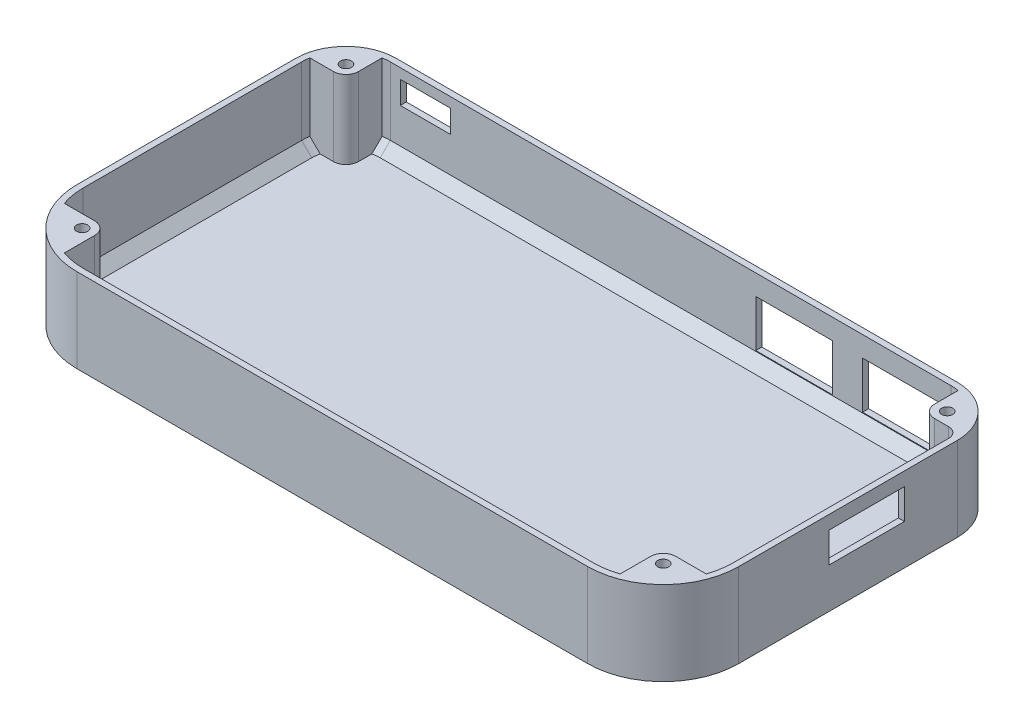
from build123d import *

# Parameters (mm, degrees)
ESBO_O1_W                   = 131.4
ESBO_O1_H                   = 68.4
BASE_DEPTH                  = 1.2
FILETE1_R                   = 15
FILETE2_R                   = 15
FILETE3_R                   = 10
FILETE4_R                   = 10
PAREDES_START               = 15.5
PAREDES_DEPTH               = 15.5
ESBO_O6_R                   = 2.5
SUPORTE_DOS_PARAFUSOS_DEPTH = 15.5
ESBO_O7_R                   = 1.1
FURO_DOS_PARAFUSOS_DEPTH    = 6
FECHAMENTOS_REACH           = 77.928
ESBO_O14_W                  = 10
ESBO_O14_H                  = 4.5
CORTE_DO_USB_DEPTH          = 10
ESBO_O16_W                  = 15.2
ESBO_O16_H                  = 9.3
CORTE_DAS_CHAVES_DEPTH      = 10
ESBO_O17_W                  = 15
ESBO_O17_H                  = 6
CORTE_SD_DEPTH              = 10
CHANFRO_BASE_INTERIOR_SIZE  = 2
FILETE5_R                   = 2


with BuildPart() as part:
    # Esboço1 → Base (new body)
    with BuildSketch(Plane(origin=(0, 0, 0), x_dir=(1, 0, 0), z_dir=(0, 1, 0))):
        Rectangle(ESBO_O1_W, ESBO_O1_H)
    extrude(amount=BASE_DEPTH)

    # Filete1
    filete1_edges = [part.edges().sort_by_distance(p)[0] for p in [
        (65.7, 0.6, 34.2),
    ]]
    fillet(filete1_edges, radius=FILETE1_R)

    # Filete2
    filete2_edges = [part.edges().sort_by_distance(p)[0] for p in [
        (-65.7, 0.6, 34.2),
    ]]
    fillet(filete2_edges, radius=FILETE2_R)

    # Filete3
    filete3_edges = [part.edges().sort_by_distance(p)[0] for p in [
        (65.7, 0.6, -34.2),
    ]]
    fillet(filete3_edges, radius=FILETE3_R)

    # Filete4
    filete4_edges = [part.edges().sort_by_distance(p)[0] for p in [
        (-65.7, 0.6, -34.2),
    ]]
    fillet(filete4_edges, radius=FILETE4_R)

    # Esboço5 → Paredes (add)
    with BuildSketch(Plane(origin=(0, 1.2, 0), x_dir=(1, 0, 0), z_dir=(0, 1, 0)).offset(PAREDES_START)):
        with BuildLine():
            Line((55.7, 34.2), (-55.7, 34.2))
            ThreePointArc((-55.7, 34.2), (-62.771067812, 31.271067812), (-65.7, 24.2))
            Line((-65.7, 24.2), (-65.7, -19.2))
            ThreePointArc((-65.7, -19.2), (-61.306601718, -29.806601718), (-50.7, -34.2))
            Line((-50.7, -34.2), (50.7, -34.2))
            ThreePointArc((50.7, -34.2), (61.306601718, -29.806601718), (65.7, -19.2))
            Line((65.7, -19.2), (65.7, 24.2))
            ThreePointArc((65.7, 24.2), (62.771067812, 31.271067812), (55.7, 34.2))
        make_face()
        with BuildLine():
            Line((55.7, 33), (-55.7, 33))
            ThreePointArc((-55.7, 33), (-61.922539674, 30.422539674), (-64.5, 24.2))
            Line((-64.5, 24.2), (-64.5, -19.2))
            ThreePointArc((-64.5, -19.2), (-60.45807358, -28.95807358), (-50.7, -33))
            Line((-50.7, -33), (50.7, -33))
            ThreePointArc((50.7, -33), (60.45807358, -28.95807358), (64.5, -19.2))
            Line((64.5, -19.2), (64.5, 24.2))
            ThreePointArc((64.5, 24.2), (61.922539674, 30.422539674), (55.7, 33))
        make_face(mode=Mode.SUBTRACT)
    extrude(amount=-PAREDES_DEPTH)

    # Esboço6 → Suporte dos parafusos (add)
    with BuildSketch(Plane(origin=(0, 1.2, 0), x_dir=(1, 0, 0), z_dir=(0, 1, 0))):
        with Locations(Location((-59.7, 28.2, 0), (0, 0, 90))):
            Circle(ESBO_O6_R)
        with Locations(Location((-57.7, -26.2, 0), (0, 0, 90))):
            Circle(ESBO_O6_R)
        with Locations(Location((59.7, 28.2, 0), (0, 0, 90))):
            Circle(ESBO_O6_R)
        with Locations(Location((57.7, -26.2, 0), (0, 0, 90))):
            Circle(ESBO_O6_R)
    extrude(amount=SUPORTE_DOS_PARAFUSOS_DEPTH)

    # Esboço7 → Furo dos parafusos (cut)
    with BuildSketch(Plane(origin=(0, 16.7, 0), x_dir=(1, 0, 0), z_dir=(0, 1, 0))):
        with Locations(Location((-59.7, 28.2, 0), (0, 0, 270))):
            Circle(ESBO_O7_R)
        with Locations(Location((59.7, 28.2, 0), (0, 0, 270))):
            Circle(ESBO_O7_R)
        with Locations(Location((57.7, -26.2, 0), (0, 0, 270))):
            Circle(ESBO_O7_R)
        with Locations(Location((-57.7, -26.2, 0), (0, 0, 270))):
            Circle(ESBO_O7_R)
    extrude(amount=-FURO_DOS_PARAFUSOS_DEPTH, mode=Mode.SUBTRACT)

    # Esboço23 → Fechamentos (add, up to next)
    with BuildSketch(Plane(origin=(0, 16.7, 0), x_dir=(1, 0, 0), z_dir=(0, 1, 0)), mode=Mode.PRIVATE) as fechamentos_sk1:
        with BuildLine():
            Line((57.2, 28.2), (57.2, 32.871216754))
            ThreePointArc((57.2, 32.871216754), (61.922539674, 30.422539674), (64.371216754, 25.7))
            Line((64.371216754, 25.7), (59.7, 25.7))
            Line((59.7, 25.7), (62.2, 28.2))
            Line((62.2, 28.2), (59.7, 30.7))
            Line((59.7, 30.7), (57.2, 28.2))
        make_face()
    fechamentos_tool1 = extrude(fechamentos_sk1.sketch, amount=-FECHAMENTOS_REACH, mode=Mode.PRIVATE) - part.part
    # Esboço23 → Fechamentos (add, up to next)
    with BuildSketch(Plane(origin=(0, 16.7, 0), x_dir=(1, 0, 0), z_dir=(0, 1, 0)), mode=Mode.PRIVATE) as fechamentos_sk2:
        with BuildLine():
            Line((-59.7, 25.7), (-64.371216754, 25.7))
            ThreePointArc((-64.371216754, 25.7), (-61.922539674, 30.422539674), (-57.2, 32.871216754))
            Line((-57.2, 32.871216754), (-57.2, 28.2))
            Line((-57.2, 28.2), (-59.7, 30.7))
            Line((-59.7, 30.7), (-62.2, 28.2))
            Line((-62.2, 28.2), (-59.7, 25.7))
        make_face()
    fechamentos_tool2 = extrude(fechamentos_sk2.sketch, amount=-FECHAMENTOS_REACH, mode=Mode.PRIVATE) - part.part
    # Esboço23 → Fechamentos (add, up to next)
    with BuildSketch(Plane(origin=(0, 16.7, 0), x_dir=(1, 0, 0), z_dir=(0, 1, 0)), mode=Mode.PRIVATE) as fechamentos_sk3:
        with BuildLine():
            Line((57.7, -23.7), (63.745688943, -23.7))
            ThreePointArc((63.745688943, -23.7), (60.45807358, -28.95807358), (55.2, -32.245688943))
            Line((55.2, -32.245688943), (55.2, -26.2))
            Line((55.2, -26.2), (57.7, -28.7))
            Line((57.7, -28.7), (60.2, -26.2))
            Line((60.2, -26.2), (57.7, -23.7))
        make_face()
    fechamentos_tool3 = extrude(fechamentos_sk3.sketch, amount=-FECHAMENTOS_REACH, mode=Mode.PRIVATE) - part.part
    # Esboço23 → Fechamentos (add, up to next)
    with BuildSketch(Plane(origin=(0, 16.7, 0), x_dir=(1, 0, 0), z_dir=(0, 1, 0)), mode=Mode.PRIVATE) as fechamentos_sk4:
        with BuildLine():
            Line((-55.2, -26.2), (-55.2, -32.245688943))
            ThreePointArc((-55.2, -32.245688943), (-60.45807358, -28.95807358), (-63.745688943, -23.7))
            Line((-63.745688943, -23.7), (-57.7, -23.7))
            Line((-57.7, -23.7), (-60.2, -26.2))
            Line((-60.2, -26.2), (-57.7, -28.7))
            Line((-57.7, -28.7), (-55.2, -26.2))
        make_face()
    fechamentos_tool4 = extrude(fechamentos_sk4.sketch, amount=-FECHAMENTOS_REACH, mode=Mode.PRIVATE) - part.part
    add(fechamentos_tool1.solids().sort_by_distance((57.301416, 16.7, -30.535608))[0])
    add(fechamentos_tool2.solids().sort_by_distance((-62.035608, 16.7, -25.801416))[0])
    add(fechamentos_tool3.solids().sort_by_distance((59.019684, 16.7, 27.519684))[0])
    add(fechamentos_tool4.solids().sort_by_distance((-59.019684, 16.7, 27.519684))[0])

    # Esboço14 → Corte do USB (cut)
    with BuildSketch(Plane(origin=(0, 0, -34.2), x_dir=(-1, 0, 0), z_dir=(0, 0, -1))):
        with Locations((48.7, 12.45)):
            Rectangle(ESBO_O14_W, ESBO_O14_H)
    extrude(amount=-CORTE_DO_USB_DEPTH, mode=Mode.SUBTRACT)

    # Esboço16 → Corte das chaves (cut)
    with BuildSketch(Plane(origin=(0, 0, -34.2), x_dir=(-1, 0, 0), z_dir=(0, 0, -1))):
        with Locations((-45.7, 8)):
            Rectangle(ESBO_O16_W, ESBO_O16_H)
        with Locations((-24.5, 8)):
            Rectangle(ESBO_O16_W, ESBO_O16_H)
    extrude(amount=-CORTE_DAS_CHAVES_DEPTH, mode=Mode.SUBTRACT)

    # Esboço17 → Corte SD (cut)
    with BuildSketch(Plane(origin=(65.7, 0, 0), x_dir=(0, 0, -1), z_dir=(1, 0, 0))):
        with Locations((6.2, 11)):
            Rectangle(ESBO_O17_W, ESBO_O17_H)
    extrude(amount=-CORTE_SD_DEPTH, mode=Mode.SUBTRACT)

    # Chanfro base interior
    chanfro_base_interior_edges = [part.edges().sort_by_distance(p)[0] for p in [
        (56.452759112, 1.2, -32.967745076),
        (-64.467745076, 1.2, -24.952759112),
        (64.310115859, 1.2, 21.481391306),
        (-52.981391306, 1.2, 32.810115859),
        (64.467745076, 1.2, -24.952759112),
        (0, 1.2, -33),
        (-56.452759112, 1.2, -32.967745076),
        (-64.5, 1.2, -2.5),
        (-64.310115859, 1.2, 21.481391306),
        (0, 1.2, 33),
        (52.981391306, 1.2, 32.810115859),
        (64.5, 1.2, -2.5),
    ]]
    chamfer(chanfro_base_interior_edges, length=CHANFRO_BASE_INTERIOR_SIZE)

    # Filete5
    # the kernel refuses this fillet: 2 mm, written as the material it adds along each edge
    with BuildSketch(Plane(origin=(64.371216754, 16.7, -25.7), x_dir=(0.06425854366242006, 0, 0.9979332841259403), z_dir=(0, -1, 0))) as filete5_piece_1_section:
        with BuildLine():
            CenterArc((1.875624905, 1.995866568), FILETE5_R, 183.684281821, 90)
            Line((-0.120241664, 1.867349481), (-0.31982832, 1.854497772))
            Line((-0.31982832, 1.854497772), (-0.199586657, -0.012851709))
            Line((-0.199586657, -0.012851709), (-0.021356822, -0.198856446))
            ThreePointArc((-0.021356822, -0.198856446), (1.518027059, -0.231715929), (2.016993701, -0.199586657))
            Line((2.016993701, -0.199586657), (2.004141992, 0))
        make_face()
    filete5_piece_1 = extrude(amount=18.51035498, mode=Mode.PRIVATE)
    filete5_piece_1 = split(filete5_piece_1, bisect_by=Plane(origin=(63.917041989, 0, -25.117041989), z_dir=(0, 1, 0)), keep=Keep.TOP, mode=Mode.PRIVATE)
    add(filete5_piece_1)


solid = part.part
